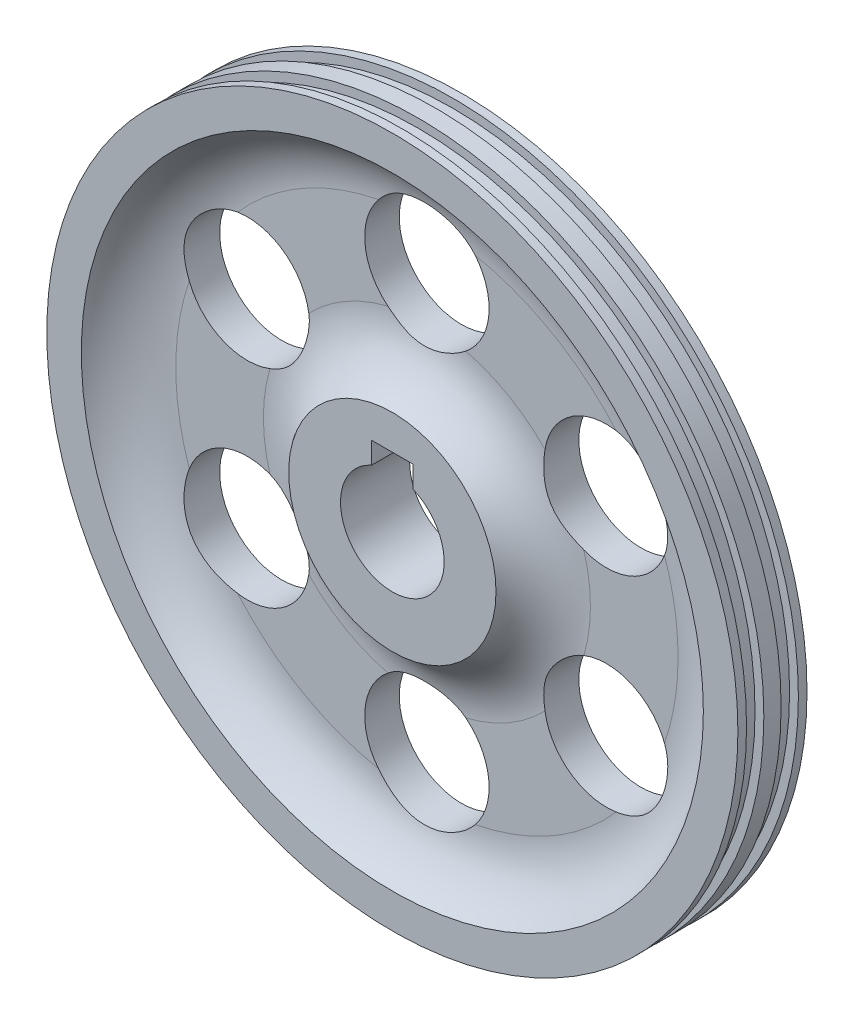
from build123d import *

# Parameters (mm, degrees)
RADYUS11_R            = 10
RADYUS12_R            = 10
KES_EKSTR_ZYON1_START = -45
IZIM2_R               = 9
KES_EKSTR_ZYON1_DEPTH = 45


with BuildPart() as part:
    # Çizim1 → Döndür1 (revolve)
    with BuildSketch(Plane(origin=(0, 0, 0), x_dir=(0, 0, -1), z_dir=(1, 0, 0)), mode=Mode.PRIVATE) as d_nd_r1_sk:
        Polygon((-0.276550708, 7.5), (9.723449292, 7.5), (9.723449292, 50), (8.473449292, 50), (8.473449292, 48.727761402), (5.973449292, 48.727761402), (5.973449292, 50), (3.473449292, 50), (3.473449292, 48.727761402), (0.973449292, 48.727761402), (0.973449292, 50), (-0.276550708, 50), (-0.276550708, 45), (4.723449292, 45), (4.723449292, 15), (-0.276550708, 15), align=None)
    revolve(d_nd_r1_sk.sketch.rotate(Axis((0, 0, 0), (0, 0, -1)), 90), axis=Axis((0, 0, 0), (0, 0, -1)))

    # Radyus11
    # the kernel refuses this fillet: 10 mm, written as the material it adds along each edge
    with BuildSketch(Plane(origin=(0, 0, -4.723449292), x_dir=(1, 0, 0), z_dir=(0, 1, 0))) as radyus11_piece_1:
        with BuildLine():
            CenterArc((23.660254038, -10), RADYUS11_R, 90, 60)
            Line((15, -5), (14.826794919, -4.9))
            ThreePointArc((14.826794919, -4.9), (14.8, -2.5), (14.8, 0))
            Line((14.8, 0), (15, 0.2))
            Line((15, 0.2), (23.660254038, 0.2))
            Line((23.660254038, 0.2), (23.660254038, 0))
        make_face()
    revolve(axis=Axis((0, 0, -4.723449292), (0, 0, -1)))

    # Radyus12
    # the kernel refuses this fillet: 10 mm, written as the material it adds along each edge
    with BuildSketch(Plane(origin=(0, 0, -4.723449292), x_dir=(1, 0, 0), z_dir=(0, 1, 0))) as radyus12_piece_1:
        with BuildLine():
            CenterArc((36.339745962, -10), RADYUS12_R, 30, 60)
            Line((45, -5), (45.173205081, -4.9))
            ThreePointArc((45.173205081, -4.9), (45.2, -2.5), (45.2, 0))
            Line((45.2, 0), (45, 0.2))
            Line((45, 0.2), (36.339745962, 0.2))
            Line((36.339745962, 0.2), (36.339745962, 0))
        make_face()
    revolve(axis=Axis((0, 0, -4.723449292), (0, 0, -1)))

    # Çizim2 → Kes-Ekstrüzyon1 (cut)
    with BuildSketch(Plane.XY.offset(0.276550708).offset(KES_EKSTR_ZYON1_START)):
        with Locations((0, 30)):
            Circle(IZIM2_R)
        with Locations((25.980762114, 15)):
            Circle(IZIM2_R)
        with Locations((25.980762114, -15)):
            Circle(IZIM2_R)
        with Locations((0, -30)):
            Circle(IZIM2_R)
        with Locations((-25.980762114, -15)):
            Circle(IZIM2_R)
        with Locations((-25.980762114, 15)):
            Circle(IZIM2_R)
        with BuildLine():
            Line((-3, 10), (3, 10))
            Line((3, 10), (3, 6.873863542))
            ThreePointArc((3, 6.873863542), (0, 7.5), (-3, 6.873863542))
            Line((-3, 6.873863542), (-3, 10))
        make_face()
    extrude(amount=KES_EKSTR_ZYON1_DEPTH, mode=Mode.SUBTRACT)


solid = part.part
